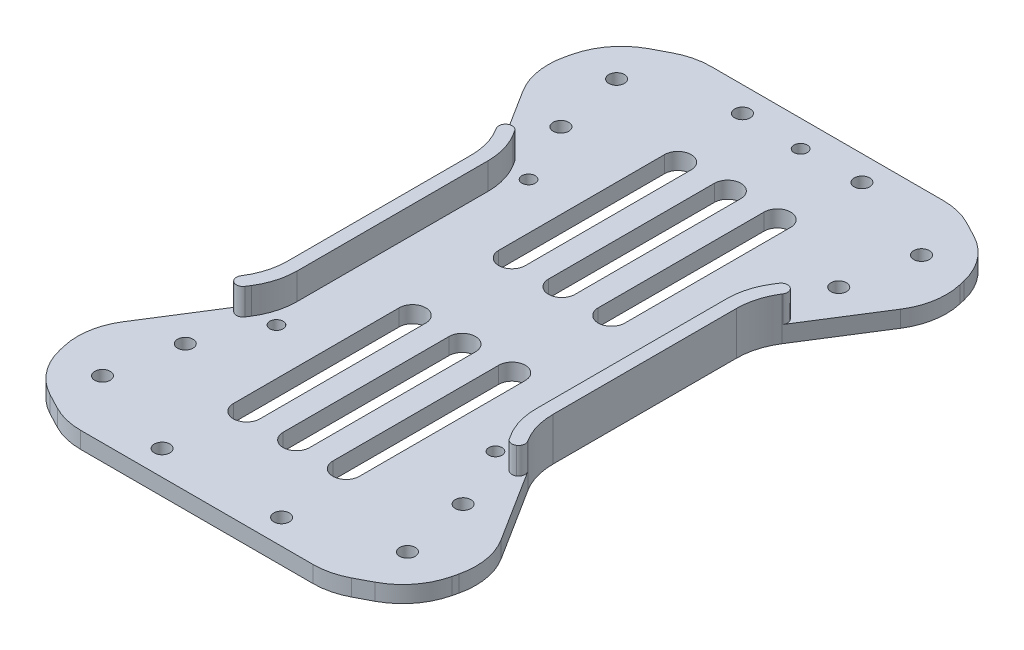
from build123d import *

# Parameters (mm, degrees)
ESQUISSE1_R             = 2.3500000000000014
ESQUISSE1_R_2           = 2.3499999999999983
ESQUISSE1_R_3           = 2.349999999999996
BOSS_EXTRU_1_DEPTH      = 5
BOSS_EXTRU_2_DEPTH      = 8
CONG_3_R                = 2
CONG_4_R                = 20
ESQUISSE4_R             = 2.0000000000000036
ENL_V_MAT_EXTRU_1_DEPTH = 114.86737128447481
CONG_5_R                = 20
ENL_V_MAT_EXTRU_2_DEPTH = 114.40537131563231
BOSS_EXTRU_3_DEPTH      = 5
CONG_6_R                = 20
CONG_7_R                = 20
ESQUISSE7_R             = 2.000000000000001
ENL_V_MAT_EXTRU_3_DEPTH = 10


with BuildPart() as part:
    # Esquisse1 → Boss.-Extru.1 (new body)
    with BuildSketch(Plane(origin=(0, 0, 0), x_dir=(1, 0, 0), z_dir=(0, 1, 0))):
        Polygon((39.99999999999999, -95.00000000000003), (-40, -95.00000000000001), (-61.41480475615327, -67.3159587983287), (-40, -33.41030108504288), (-40, 33.41030108504288), (-61.41480475615327, 67.31595879832868), (-39.99999999999999, 95.00000000000001), (39.99999999999999, 95.00000000000003), (61.414804756153316, 67.31595879832868), (40.000000000000014, 33.41030108504289), (40.000000000000014, -33.41030108504289), (61.414804756153316, -67.31595879832868), align=None)
        with Locations(Location((18.009715939773823, 87.47156012506183, 0), (0, 0, 270))):
            Circle(ESQUISSE1_R, mode=Mode.SUBTRACT)
        with Locations(Location((45.96329382727553, 77.48820598648535, 0), (0, 0, 270))):
            Circle(ESQUISSE1_R_2, mode=Mode.SUBTRACT)
        with Locations(Location((41.871926953773496, 56.623628500342335, 0), (0, 0, 270))):
            Circle(ESQUISSE1_R_3, mode=Mode.SUBTRACT)
        with Locations(Location((-41.871926953773496, 56.623628500342335, 0), (0, 0, 90))):
            Circle(ESQUISSE1_R_3, mode=Mode.SUBTRACT)
        with Locations(Location((-45.96329382727553, 77.48820598648535, 0), (0, 0, 90))):
            Circle(ESQUISSE1_R_2, mode=Mode.SUBTRACT)
        with Locations(Location((-18.009715939773823, 87.47156012506183, 0), (0, 0, 90))):
            Circle(ESQUISSE1_R, mode=Mode.SUBTRACT)
        with Locations(Location((41.871926953773496, -56.623628500342335, 0), (0, 0, 90))):
            Circle(ESQUISSE1_R_3, mode=Mode.SUBTRACT)
        with Locations(Location((45.963293827275415, -77.48820598648535, 0), (0, 0, 90))):
            Circle(ESQUISSE1_R_2, mode=Mode.SUBTRACT)
        with Locations(Location((18.00971593977377, -87.47156012506183, 0), (0, 0, 90))):
            Circle(ESQUISSE1_R, mode=Mode.SUBTRACT)
        with Locations(Location((-18.00971593977388, -87.47156012506183, 0), (0, 0, 270))):
            Circle(ESQUISSE1_R, mode=Mode.SUBTRACT)
        with Locations(Location((-45.96329382727556, -77.48820598648535, 0), (0, 0, 270))):
            Circle(ESQUISSE1_R_2, mode=Mode.SUBTRACT)
        with Locations(Location((-41.871926953773496, -56.623628500342335, 0), (0, 0, 270))):
            Circle(ESQUISSE1_R_3, mode=Mode.SUBTRACT)
    extrude(amount=BOSS_EXTRU_1_DEPTH)

    # Esquisse3 → Boss.-Extru.2 (add)
    with BuildSketch(Plane(origin=(0, 5, 0), x_dir=(1, 0, 0), z_dir=(0, 1, 0))):
        Polygon((40.000000000000014, -33.41030108504289), (40.000000000000014, 33.41030108504289), (44.27204448885784, 40.174148798084595), (40.89012063233698, 42.31017104251351), (36.00000000000002, 34.567734993029916), (36.00000000000003, -34.56773499302995), (40.89012063233698, -42.31017104251351), (44.27204448885783, -40.174148798084595), align=None)
        Polygon((-40.89012063233699, -42.31017104251351), (-36.00000000000003, -34.56773499302995), (-36.00000000000002, 34.567734993029916), (-40.89012063233698, 42.31017104251351), (-44.272044488857844, 40.174148798084595), (-40.000000000000014, 33.41030108504289), (-40.000000000000014, -33.41030108504289), (-44.27204448885783, -40.174148798084595), align=None)
    extrude(amount=BOSS_EXTRU_2_DEPTH)

    # Congé3
    cong_3_edges = [part.edges().sort_by_distance(p)[0] for p in [
        (-40.89012063233698, 9, -42.31017104251351),
        (-44.272044488857844, 9, -40.174148798084595),
        (-44.27204448885783, 9, 40.174148798084595),
        (-40.89012063233699, 9, 42.31017104251351),
        (40.89012063233698, 9, 42.31017104251351),
        (44.27204448885783, 9, 40.174148798084595),
        (40.89012063233698, 9, -42.31017104251351),
        (44.27204448885784, 9, -40.174148798084595),
    ]]
    fillet(cong_3_edges, radius=CONG_3_R - 0.0001)  # a hair under: the kernel refuses the full size

    # Congé4
    cong_4_edges = [part.edges().sort_by_distance(p)[0] for p in [
        (-40.00000000000001, 6.5, 33.41030108504289),
        (-40.00000000000001, 6.5, -33.41030108504289),
        (40.000000000000014, 6.5, -33.41030108504289),
        (40.000000000000014, 6.5, 33.41030108504289),
    ]]
    fillet(cong_4_edges, radius=CONG_4_R)

    # Esquisse4 → Enlèv. mat.-Extru.1 (cut, through all)
    with BuildSketch(Plane(origin=(0, 0, 0), x_dir=(-1, 0, 0), z_dir=(0, -1, 0))):
        with Locations(Location((32.99999999999999, -38.000000000000014, 0), (0, 0, 90))):
            Circle(ESQUISSE4_R)
        with Locations(Location((33.00000000000002, 38, 0), (0, 0, 90))):
            Circle(ESQUISSE4_R)
        with Locations(Location((-32.99999999999999, -38.000000000000014, 0), (0, 0, 90))):
            Circle(ESQUISSE4_R)
        with Locations(Location((-33.00000000000002, 38, 0), (0, 0, 90))):
            Circle(ESQUISSE4_R)
    extrude(amount=-ENL_V_MAT_EXTRU_1_DEPTH, mode=Mode.SUBTRACT)

    # Congé5
    cong_5_edges = [part.edges().sort_by_distance(p)[0] for p in [
        (-36.00000000000003, 9, 34.56773499302995),
        (-36.00000000000002, 9, -34.567734993029916),
        (36.00000000000002, 9, -34.567734993029916),
        (36.00000000000003, 9, 34.56773499302995),
    ]]
    fillet(cong_5_edges, radius=CONG_5_R)

    # Esquisse5 → Enlèv. mat.-Extru.2 (cut, through all)
    with BuildSketch(Plane(origin=(0, 5, 0), x_dir=(1, 0, 0), z_dir=(0, 1, 0))):
        with BuildLine():
            Line((-19, -65), (-19.00000000000001, -15))
            ThreePointArc((-19.00000000000001, -15), (-15.000000000000002, -10.999999999999979), (-10.999999999999988, -15.000000000000014))
            Line((-10.999999999999988, -15.000000000000014), (-10.999999999999979, -64.99999999999999))
            ThreePointArc((-10.999999999999979, -64.99999999999999), (-14.999999999999993, -69), (-19, -65))
        make_face()
        with BuildLine():
            Line((19.00000000000002, -64.99999999999999), (19.00000000000001, -15))
            ThreePointArc((19.00000000000001, -15), (15.000000000000005, -10.999999999999961), (10.99999999999997, -15.000000000000007))
            Line((10.99999999999997, -15.000000000000007), (10.999999999999979, -64.99999999999999))
            ThreePointArc((10.999999999999979, -64.99999999999999), (15.000000000000016, -68.99999999999999), (19.00000000000002, -64.99999999999999))
        make_face()
        with BuildLine():
            Line((19.00000000000002, 64.99999999999999), (19.00000000000001, 15))
            ThreePointArc((19.00000000000001, 15), (15.000000000000009, 10.99999999999998), (10.99999999999999, 15))
            Line((10.99999999999999, 15), (10.999999999999979, 64.99999999999999))
            ThreePointArc((10.999999999999979, 64.99999999999999), (15.000000000000016, 68.99999999999999), (19.00000000000002, 64.99999999999999))
        make_face()
        with BuildLine():
            Line((-19.00000000000002, 64.99999999999999), (-19.00000000000001, 15))
            ThreePointArc((-19.00000000000001, 15), (-15.000000000000009, 10.99999999999998), (-10.99999999999999, 15))
            Line((-10.99999999999999, 15), (-10.999999999999979, 64.99999999999999))
            ThreePointArc((-10.999999999999979, 64.99999999999999), (-15.000000000000016, 68.99999999999999), (-19.00000000000002, 64.99999999999999))
        make_face()
        with BuildLine():
            Line((-4, -64.99999999999999), (-4, -15))
            ThreePointArc((-4, -15), (2.4e-16, -11), (4, -15))
            Line((4, -15), (4, -64.99999999999999))
            ThreePointArc((4, -64.99999999999999), (-7.3e-16, -68.99999999999999), (-4, -64.99999999999999))
        make_face()
        with BuildLine():
            Line((-4, 64.99999999999999), (-4, 15))
            ThreePointArc((-4, 15), (2.4e-16, 11), (4, 15))
            Line((4, 15), (4, 64.99999999999999))
            ThreePointArc((4, 64.99999999999999), (2.4e-16, 68.99999999999999), (-4, 64.99999999999999))
        make_face()
    extrude(amount=-ENL_V_MAT_EXTRU_2_DEPTH, mode=Mode.SUBTRACT)

    # Esquisse6 → Boss.-Extru.3 (add)
    with BuildSketch(Plane(origin=(0, 5, 0), x_dir=(1, 0, 0), z_dir=(0, 1, 0))):
        Polygon((-61.41480475615327, 67.31595879832868), (-57.03518322417293, 86.05279191485651), (-39.99999999999999, 95.00000000000001), align=None)
        Polygon((57.03518322417293, 86.05279191485651), (39.99999999999999, 95.00000000000001), (61.41480475615327, 67.31595879832868), align=None)
        Polygon((61.41480475615317, -67.31595879832868), (57.03518322417293, -86.05279191485651), (39.999999999999886, -95.00000000000001), align=None)
        Polygon((-57.03518322417293, -86.05279191485651), (-40.00000000000002, -95.00000000000001), (-61.4148047561533, -67.31595879832868), align=None)
    extrude(amount=-BOSS_EXTRU_3_DEPTH)

    # Congé6
    cong_6_edges = [part.edges().sort_by_distance(p)[0] for p in [
        (-57.03518322417293, 2.5, -86.05279191485651),
        (57.03518322417293, 2.5, -86.05279191485651),
        (57.03518322417293, 2.5, 86.05279191485651),
        (-57.03518322417293, 2.5, 86.05279191485651),
    ]]
    fillet(cong_6_edges, radius=CONG_6_R)

    # Congé7
    cong_7_edges = [part.edges().sort_by_distance(p)[0] for p in [
        (-40, 2.5, 95.00000000000001),
        (-61.41480475615327, 2.5, 67.3159587983287),
        (39.99999999999999, 2.5, 95.00000000000003),
        (61.414804756153316, 2.5, 67.31595879832868),
        (61.414804756153316, 2.5, -67.31595879832868),
        (39.99999999999999, 2.5, -95.00000000000003),
        (-61.41480475615327, 2.5, -67.31595879832868),
        (-39.99999999999999, 2.5, -95.00000000000001),
    ]]
    fillet(cong_7_edges, radius=CONG_7_R)

    # Esquisse7 → Enlèv. mat.-Extru.3 (cut)
    with BuildSketch(Plane(origin=(0, 0, 0), x_dir=(-1, 0, 0), z_dir=(0, -1, 0))):
        with Locations(Location((3.47e-15, 86.99999999999997, 0), (0, 0, 90))):
            Circle(ESQUISSE7_R)
    extrude(amount=-ENL_V_MAT_EXTRU_3_DEPTH, mode=Mode.SUBTRACT)


solid = part.part
